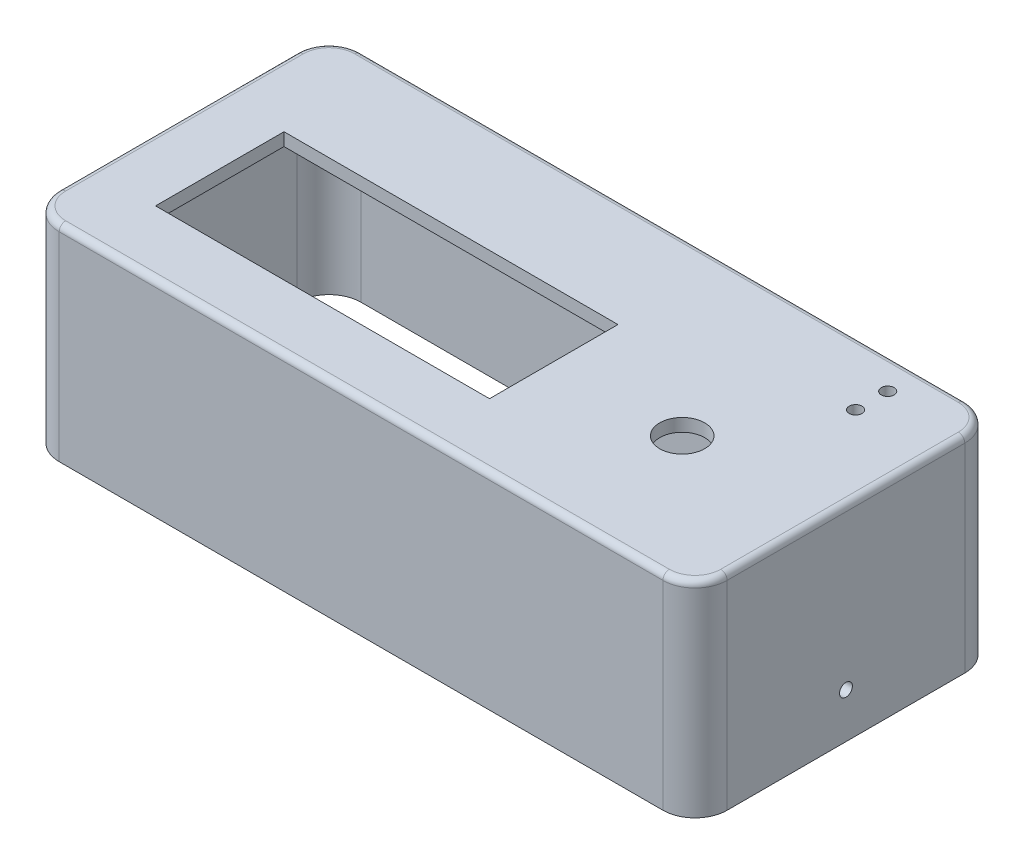
from build123d import *

# Parameters (mm, degrees)
SKETCH_1_W               = 52
SKETCH_1_H               = 20
SKETCH_1_R               = 1
SKETCH_1_R_2             = 3.5
EXTRUDE_1_DEPTH          = 2
EXTRUDE_2_DEPTH          = 32
FILLET_2_R               = 1
CUT_EXTRUDE_1_DEPTH      = 113.11155159
CUT_EXTRUDE_1_DEPTH_BACK = 113.11155159
SKETCH_2_R               = 1
SKETCH_3_W               = 12
SKETCH_3_H               = 10
CUT_EXTRUDE_2_DEPTH      = 10


with BuildPart() as part:
    # Эскиз1 → Бобышка-Вытянуть1 (new body)
    with BuildSketch(Plane(origin=(0, 0, 0), x_dir=(1, 0, 0), z_dir=(0, 1, 0))):
        with BuildLine():
            Line((61, 25), (-29, 25))
            ThreePointArc((-29, 25), (-32.535533906, 23.535533906), (-34, 20))
            Line((-34, 20), (-34, -13))
            ThreePointArc((-34, -13), (-32.535533906, -16.535533906), (-29, -18))
            Line((-29, -18), (61, -18))
            ThreePointArc((61, -18), (64.535533906, -16.535533906), (66, -13))
            Line((66, -13), (66, 20))
            ThreePointArc((66, 20), (64.535533906, 23.535533906), (61, 25))
        make_face()
        Rectangle(SKETCH_1_W, SKETCH_1_H, mode=Mode.SUBTRACT)
        with Locations((56, 17)):
            Circle(SKETCH_1_R, mode=Mode.SUBTRACT)
        with Locations((56, 22)):
            Circle(SKETCH_1_R, mode=Mode.SUBTRACT)
        with Locations((46, 0)):
            Circle(SKETCH_1_R_2, mode=Mode.SUBTRACT)
    extrude(amount=-EXTRUDE_1_DEPTH)

    # Эскиз1<3> → Бобышка-Вытянуть2 (add)
    with BuildSketch(Plane(origin=(0, 0, 0), x_dir=(1, 0, 0), z_dir=(0, 1, 0))):
        with BuildLine():
            Line((63, 27), (-31, 27))
            ThreePointArc((-31, 27), (-34.535533906, 25.535533906), (-36, 22))
            Line((-36, 22), (-36, -15))
            ThreePointArc((-36, -15), (-34.535533906, -18.535533906), (-31, -20))
            Line((-31, -20), (63, -20))
            ThreePointArc((63, -20), (66.535533906, -18.535533906), (68, -15))
            Line((68, -15), (68, 22))
            ThreePointArc((68, 22), (66.535533906, 25.535533906), (63, 27))
        make_face()
        with BuildLine():
            ThreePointArc((-34, 20), (-32.535533906, 23.535533906), (-29, 25))
            Line((-29, 25), (61, 25))
            ThreePointArc((61, 25), (64.535533906, 23.535533906), (66, 20))
            Line((66, 20), (66, -13))
            ThreePointArc((66, -13), (64.535533906, -16.535533906), (61, -18))
            Line((61, -18), (-29, -18))
            ThreePointArc((-29, -18), (-32.535533906, -16.535533906), (-34, -13))
            Line((-34, -13), (-34, 20))
        make_face(mode=Mode.SUBTRACT)
    extrude(amount=-EXTRUDE_2_DEPTH)

    # Скругление2
    fillet_2_edges = [part.edges().sort_by_distance(p)[0] for p in [
        (68, 0, -3.5),
        (16, 0, -27),
        (-36, 0, -3.5),
        (16, 0, 20),
        (-34.535533906, 0, 18.535533906),
        (-34.535533906, 0, -25.535533906),
        (66.535533906, 0, -25.535533906),
        (66.535533906, 0, 18.535533906),
    ]]
    fillet(fillet_2_edges, radius=FILLET_2_R)

    # Эскиз2 → Вырез-Вытянуть1 (cut, two sides: drawn at the far end of the back side and taken through both)
    with BuildSketch(Plane(origin=(68, 0, 0), x_dir=(0, 0, -1), z_dir=(1, 0, 0)).offset(-CUT_EXTRUDE_1_DEPTH_BACK)):
        with Locations((3.5, -25)):
            Circle(SKETCH_2_R)
    extrude(amount=CUT_EXTRUDE_1_DEPTH + CUT_EXTRUDE_1_DEPTH_BACK, mode=Mode.SUBTRACT)

    # Эскиз3 → Вырез-Вытянуть2 (cut)
    with BuildSketch(Plane.XY.offset(-25)):
        with Locations((55, -27)):
            Rectangle(SKETCH_3_W, SKETCH_3_H)
    extrude(amount=-CUT_EXTRUDE_2_DEPTH, mode=Mode.SUBTRACT)


solid = part.part
